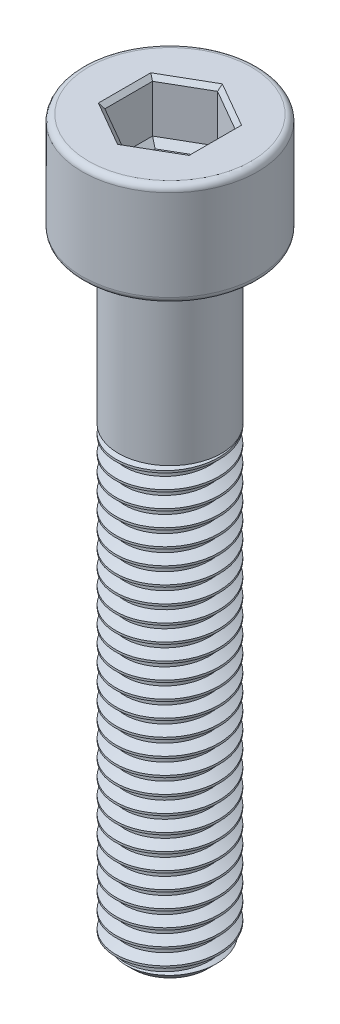
from build123d import *

# Parameters (mm, degrees)
SKETCH1_R           = 2.5
BOSS_EXTRUDE1_DEPTH = 22
THREAD1_PITCH       = 0.8
SKETCH2_R           = 2.5
BOSS_EXTRUDE2_DEPTH = 8
SKETCH3_R           = 4.25
BOSS_EXTRUDE3_DEPTH = 5
FILLET1_R           = 0.3
CUT_EXTRUDE1_DEPTH  = 2.5
CHAMFER1_SIZE       = 0.2
CUT_EXTRUDE2_DEPTH  = 0.3
CUT_EXTRUDE2_DRAFT  = -45


with BuildPart() as part:
    # Sketch1 → Boss-Extrude1 (new body)
    with BuildSketch(Plane(origin=(0, 0, 0), x_dir=(1, 0, 0), z_dir=(0, 1, 0))):
        with Locations(Location((0, 0, 0), (0, 0, 270))):
            Circle(SKETCH1_R)
    extrude(amount=BOSS_EXTRUDE1_DEPTH)

    # Thread1: arcs per turn and ends read off the stored shape
    # Thread1: the profile of Thread Profile1 profile screwed along a right-hand helix through 30 turns, 8 arcs to a turn; built about Z, then put on its axis
    thread1_z = Axis((0, 0, 0), (0, 0, 1))
    thread1_corners = [(2.5003, 0, -0.000173205), (2.5003, 0, 0.700173203), (2.0669873, 0, 0.449999999), (2.0669873, 0, 0.249999999)]
    with BuildLine(mode=Mode.PRIVATE) as thread1_profile:
        Line(thread1_corners[0], thread1_corners[1])
        Line(thread1_corners[1], thread1_corners[2])
        Line(thread1_corners[2], thread1_corners[3])
        Line(thread1_corners[3], thread1_corners[0])
    thread1_cap = Face(thread1_profile.wire())
    thread1_turn_angles = [0, 22.5, 45, 67.5, 90, 112.5, 135, 157.5, 180, 202.5, 225, 247.5, 270, 292.5, 315, 337.5, 360]
    thread1_turn_weights = [1, 0.9238795325112867, 1, 0.9238795325112867, 1, 0.9238795325112867, 1, 0.9238795325112867, 1, 0.9238795325112867, 1, 0.9238795325112867, 1, 0.9238795325112867, 1, 0.9238795325112867, 1]
    thread1_turn_rails = [Edge.make_bspline([Vector(p[0], p[1], 0).rotate(thread1_z, thread1_turn_angles[k]) / thread1_turn_weights[k] + Vector(0, 0, p[2] + THREAD1_PITCH * thread1_turn_angles[k] / 360) for k in range(17)], [0, 0, 0, 1, 1, 2, 2, 3, 3, 4, 4, 5, 5, 6, 6, 7, 7, 8, 8, 8], 2, thread1_turn_weights) for p in thread1_corners]
    thread1_turn_sides = [Face.make_surface_from_curves(thread1_turn_rails[p[0]], thread1_turn_rails[p[1]]) for p in [(0, 1), (1, 2), (2, 3), (3, 0)]]
    thread1 = Plane(origin=(0, 23, 0), x_dir=(-1, 0, 0), z_dir=(0, -1, 0)) * Solid(Shell([*[p.moved(Location((0, 0, THREAD1_PITCH * i))) for i in range(30) for p in thread1_turn_sides], thread1_cap, thread1_cap.rotate(thread1_z, 10800).moved(Location((0, 0, THREAD1_PITCH * 10800 / 360)))]))
    add(thread1, mode=Mode.SUBTRACT)

    # Sketch2 → Boss-Extrude2 (add)
    with BuildSketch(Plane(origin=(0, 22, 0), x_dir=(1, 0, 0), z_dir=(0, 1, 0))):
        with Locations(Location((0, 0, 0), (0, 0, 90))):
            Circle(SKETCH2_R)
    extrude(amount=BOSS_EXTRUDE2_DEPTH)

    # Sketch3 → Boss-Extrude3 (add)
    with BuildSketch(Plane(origin=(0, 30, 0), x_dir=(1, 0, 0), z_dir=(0, 1, 0))):
        with Locations(Location((0, 0, 0), (0, 0, 270))):
            Circle(SKETCH3_R)
    extrude(amount=BOSS_EXTRUDE3_DEPTH)

    # Fillet1
    fillet1_edges = [part.edges().sort_by_distance(p)[0] for p in [
        (0, 30, -4.25),
        (0, 35, -4.25),
    ]]
    fillet(fillet1_edges, radius=FILLET1_R)

    # Sketch4 → Cut-Revolve1 (revolve, cut)
    with BuildSketch(Plane.XY, mode=Mode.PRIVATE) as cut_revolve1_sk:
        Polygon((2.51, 0), (2.51, 0.7), (1.81, 0), align=None)
    revolve(cut_revolve1_sk.sketch.rotate(Axis((0, 0, 0), (0, 1, 0)), 90), axis=Axis((0, 0, 0), (0, 1, 0)), mode=Mode.SUBTRACT)

    # Sketch5 → Cut-Extrude1 (cut)
    with BuildSketch(Plane(origin=(0, 35, 0), x_dir=(1, 0, 0), z_dir=(0, 1, 0))):
        Polygon((0, 2.309401077), (-2, 1.154700538), (-2, -1.154700538), (0, -2.309401077), (2, -1.154700538), (2, 1.154700538), align=None)
    extrude(amount=-CUT_EXTRUDE1_DEPTH, mode=Mode.SUBTRACT)

    # Chamfer1
    chamfer1_edges = [part.edges().sort_by_distance(p)[0] for p in [
        (1, 35, -1.732050808),
        (-1, 35, -1.732050808),
        (-2, 35, 0),
        (-1, 35, 1.732050808),
        (1, 35, 1.732050808),
        (2, 35, 0),
    ]]
    chamfer(chamfer1_edges, length=CHAMFER1_SIZE)


with BuildPart() as cut_extrude2_tool:
    # Sketch6 → Cut-Extrude2 (with draft: the straight prism first)
    with BuildSketch(Plane(origin=(0, 32.5, 0), x_dir=(1, 0, 0), z_dir=(0, 1, 0))):
        Polygon((0, 2.309401077), (-2, 1.154700538), (-2, -1.154700538), (0, -2.309401077), (2, -1.154700538), (2, 1.154700538), align=None)
    extrude(amount=-CUT_EXTRUDE2_DEPTH)
    # Cut-Extrude2: the draft: its side faces are tilted about the plane it starts from
    cut_extrude2_sides = [cut_extrude2_tool.faces().sort_by_distance(p)[0] for p in [
        (-1, 32.35, -1.732050808),
        (-2, 32.35, 0),
        (-1, 32.35, 1.732050808),
        (1, 32.35, 1.732050808),
        (2, 32.35, 0),
        (1, 32.35, -1.732050808),
    ]]
    draft(cut_extrude2_sides, Plane(origin=(0, 32.5, 0), x_dir=(1, 0, 0), z_dir=(0, 1, 0)), CUT_EXTRUDE2_DRAFT)


with BuildPart() as part_1:
    add(part.part)

    # Cut-Extrude2: cut by cut_extrude2_tool
    add(cut_extrude2_tool.part, mode=Mode.SUBTRACT)


solid = part_1.part
